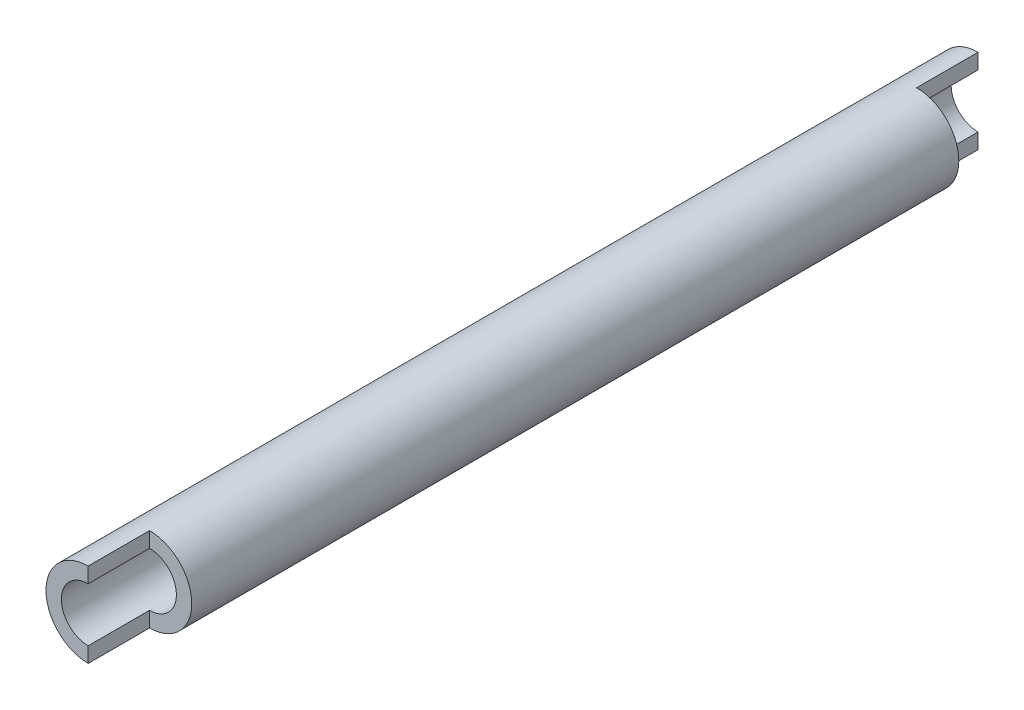
from build123d import *
from build123d.topology import SkipClean

# Parameters (mm, degrees)
SKETCH1_R                                        = 5.5
SKETCH1_R_2                                      = 3.5
BOSS_EXTRUDE1_DLUGOSC_CALKOWITA_DEPTH            = 100
BOSS_EXTRUDE2_PRZEDLUZENIE_DO_MONTAZU_DEPTH      = 8
BOSS_EXTRUDE2_PRZEDLUZENIE_DO_MONTAZU_DEPTH_BACK = 108


with BuildPart() as part:
    # Sketch1 → Boss-Extrude1 dlugosc calkowita (new body)
    with BuildSketch(Plane.XY):
        Circle(SKETCH1_R)
        Circle(SKETCH1_R_2, mode=Mode.SUBTRACT)
    extrude(amount=BOSS_EXTRUDE1_DLUGOSC_CALKOWITA_DEPTH)

    # Sketch2 → Boss-Extrude2 przedluzenie do montazu (add, two sides: drawn at the far end of the back side and taken through both)
    with SkipClean():  # the faces are left unmerged after this step: merging them gives an invalid solid
        with BuildSketch(Plane(origin=(0, 0, 0), x_dir=(-1, 0, 0), z_dir=(0, 0, -1)).offset(-BOSS_EXTRUDE2_PRZEDLUZENIE_DO_MONTAZU_DEPTH_BACK)):
            with BuildLine():
                Line((0, 5.5), (0, 3.5))
                ThreePointArc((0, 3.5), (3.5, 0), (0, -3.5))
                Line((0, -3.5), (0, -5.5))
                ThreePointArc((0, -5.5), (5.5, 0), (0, 5.5))
            make_face()
        extrude(amount=BOSS_EXTRUDE2_PRZEDLUZENIE_DO_MONTAZU_DEPTH + BOSS_EXTRUDE2_PRZEDLUZENIE_DO_MONTAZU_DEPTH_BACK)
    add(part.part.scale(1), mode=Mode.REPLACE)  # the faces are merged on a copy


solid = part.part
